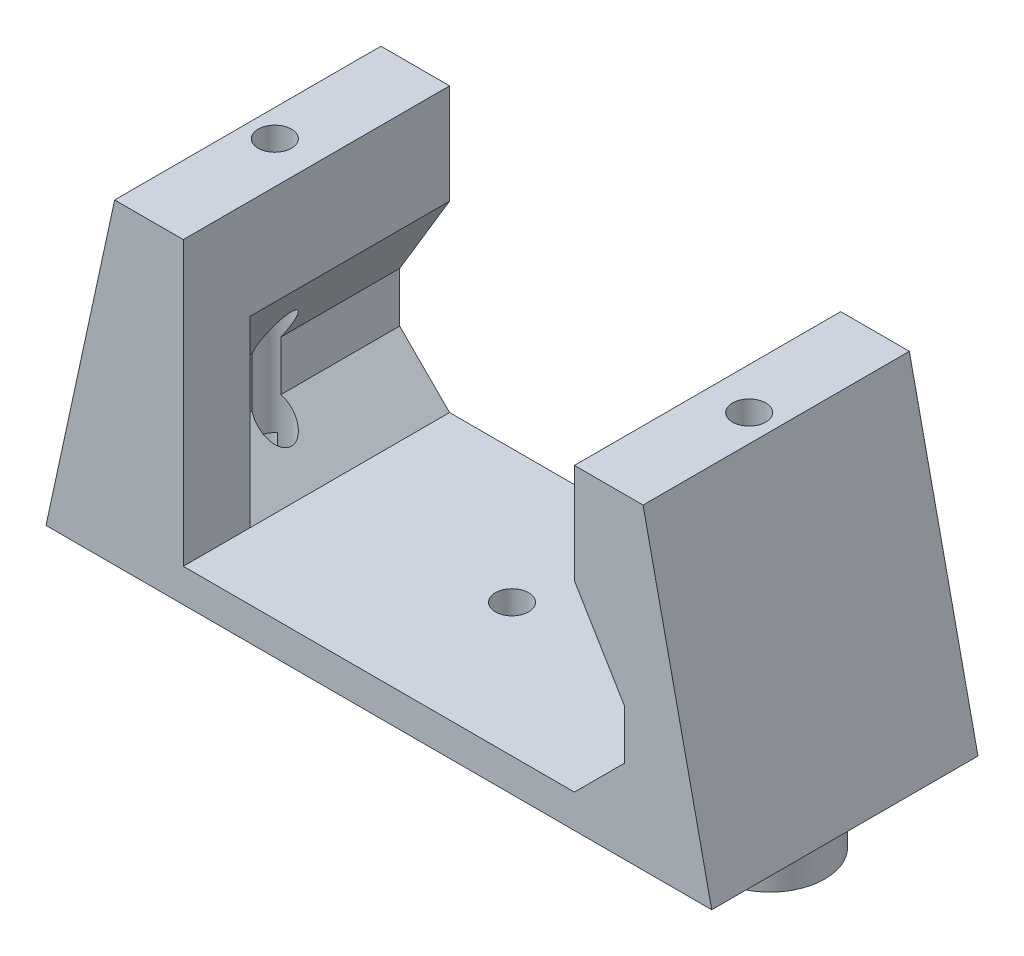
from build123d import *

# Parameters (mm, degrees)
ESBO_O1_W                = 40
ESBO_O1_H                = 16
RESSALTO_EXTRUS_O1_DEPTH = 2
ESBO_O1_4_W              = 8.25
ESBO_O1_4_H              = 16
ESBO_O1_4_R              = 1
RESSALTO_EXTRUS_O2_DEPTH = 19
ESBO_O2_R                = 3.3
ESBO_O2_R_2              = 1
RESSALTO_EXTRUS_O3_DEPTH = 3
CORTE_EXTRUS_O1_DEPTH    = 32.890437438
CORTE_EXTRUS_O3_DEPTH    = 12
CORTE_EXTRUS_O4_DEPTH    = 12
CHANFRO1_SIZE            = 3
CORTE_EXTRUS_O5_START    = -6
ESBO_O7_R                = 1
CORTE_EXTRUS_O5_DEPTH    = 6


with BuildPart() as part:
    # Esboço1 → Ressalto-extrusão1 (new body)
    with BuildSketch(Plane(origin=(0, 0, 0), x_dir=(1, 0, 0), z_dir=(0, 1, 0))):
        Rectangle(ESBO_O1_W, ESBO_O1_H)
    extrude(amount=RESSALTO_EXTRUS_O1_DEPTH)

    # Esboço1<4> → Ressalto-extrusão2 (add)
    # profile 1 of 2: a face of its own
    with BuildSketch(Plane(origin=(0, 0, 0), x_dir=(1, 0, 0), z_dir=(0, 1, 0))):
        with Locations((-15.875, 0)):
            Rectangle(ESBO_O1_4_W, ESBO_O1_4_H)
        with Locations(Location((-14.25, 0, 0), (0, 0, 270))):
            Circle(ESBO_O1_4_R, mode=Mode.SUBTRACT)
    # profile 2 of 2: a face of its own
    with BuildSketch(Plane(origin=(0, 0, 0), x_dir=(1, 0, 0), z_dir=(0, 1, 0))):
        with Locations((15.875, 0)):
            Rectangle(ESBO_O1_4_W, ESBO_O1_4_H)
        with Locations(Location((14.25, 0, 0), (0, 0, 270))):
            Circle(ESBO_O1_4_R, mode=Mode.SUBTRACT)
    extrude(amount=RESSALTO_EXTRUS_O2_DEPTH)

    # Esboço2 → Ressalto-extrusão3 (add)
    # profile 1 of 3: a face of its own
    with BuildSketch(Plane.XZ):
        with Locations(Location((0, 0, 0), (0, 0, 90))):
            Circle(ESBO_O2_R)
        with Locations(Location((0, 0, 0), (0, 0, 270))):
            Circle(ESBO_O2_R_2, mode=Mode.SUBTRACT)
    # profile 2 of 3: a face of its own
    with BuildSketch(Plane.XZ):
        with Locations(Location((-15.5, 0, 0), (0, 0, 90))):
            Circle(ESBO_O2_R)
        with Locations(Location((-15.5, 0, 0), (0, 0, 270))):
            Circle(ESBO_O2_R_2, mode=Mode.SUBTRACT)
    # profile 3 of 3: a face of its own
    with BuildSketch(Plane.XZ):
        with Locations(Location((15.5, 0, 0), (0, 0, 90))):
            Circle(ESBO_O2_R)
        with Locations(Location((15.5, 0, 0), (0, 0, 270))):
            Circle(ESBO_O2_R_2, mode=Mode.SUBTRACT)
    extrude(amount=RESSALTO_EXTRUS_O3_DEPTH)

    # Esboço3 → Corte-extrusão1 (cut, through all)
    with BuildSketch(Plane.XY.offset(8)):
        Polygon((15.875, 19), (20, 0), (20, 19), align=None)
        Polygon((-20, 0), (-15.875, 19), (-20, 19), align=None)
    extrude(amount=-CORTE_EXTRUS_O1_DEPTH, mode=Mode.SUBTRACT)

    # Esboço4 → Corte-extrusão3 (cut)
    with BuildSketch(Plane(origin=(0, 0, -8), x_dir=(-1, 0, 0), z_dir=(0, 0, -1))):
        Polygon((14.75, 8), (11.75, 13), (11.75, 5), (14.75, 5), align=None)
    extrude(amount=-CORTE_EXTRUS_O3_DEPTH, mode=Mode.SUBTRACT)

    # Esboço6 → Corte-extrusão4 (cut)
    with BuildSketch(Plane.XY.offset(8)):
        Polygon((14.75, 8), (11.75, 13), (11.75, 5), (14.75, 5), align=None)
    extrude(amount=-CORTE_EXTRUS_O4_DEPTH, mode=Mode.SUBTRACT)

    # Chanfro1
    # the kernel refuses this chamfer: 3 mm, written as the material it takes off along each edge
    with BuildSketch(Plane(origin=(11.75, 5, 15.715048964), x_dir=(-0.027495876610586202, -0.9996219169112968, 0), z_dir=(0, 0, -1))) as chanfro1_piece_1_section:
        Polygon((CHANFRO1_SIZE * 0.999621916911, -CHANFRO1_SIZE * 0.0274958766106), (-CHANFRO1_SIZE * 0.0274958766106, -CHANFRO1_SIZE * 0.999621916911), (0, 0), align=None)
    chanfro1_piece_1 = extrude(amount=19.715048964, mode=Mode.PRIVATE)
    chanfro1_piece_1 = split(chanfro1_piece_1, bisect_by=Plane(origin=(12.737731783, 2, 5.857524482), z_dir=(0, 1, 0)), keep=Keep.TOP, mode=Mode.PRIVATE)
    chanfro1_piece_1 = split(chanfro1_piece_1, bisect_by=Plane(origin=(14.75, 4.012268217, 5.857524482), z_dir=(-1, 0, 0)), keep=Keep.TOP, mode=Mode.PRIVATE)
    add(chanfro1_piece_1, mode=Mode.SUBTRACT)
    with BuildSketch(Plane(origin=(-11.75, 5, -15.715048964), x_dir=(0.027495876610586202, -0.9996219169112968, 0), z_dir=(0, 0, 1))) as chanfro1_piece_2_section:
        Polygon((CHANFRO1_SIZE * 0.999621916911, -CHANFRO1_SIZE * 0.0274958766106), (-CHANFRO1_SIZE * 0.0274958766106, -CHANFRO1_SIZE * 0.999621916911), (0, 0), align=None)
    chanfro1_piece_2 = extrude(amount=19.715048964, mode=Mode.PRIVATE)
    chanfro1_piece_2 = split(chanfro1_piece_2, bisect_by=Plane(origin=(-12.737731783, 2, -5.857524482), z_dir=(0, 1, 0)), keep=Keep.TOP, mode=Mode.PRIVATE)
    chanfro1_piece_2 = split(chanfro1_piece_2, bisect_by=Plane(origin=(-14.75, 4.012268217, -5.857524482), z_dir=(1, 0, 0)), keep=Keep.TOP, mode=Mode.PRIVATE)
    add(chanfro1_piece_2, mode=Mode.SUBTRACT)

    # Esboço7 → Corte-extrusão5 (cut)
    with BuildSketch(Plane.XZ.offset(3).offset(CORTE_EXTRUS_O5_START)):
        with Locations(Location((0, 0, 0), (0, 0, 90))):
            Circle(ESBO_O7_R)
        with Locations(Location((-15.5, 0, 0), (0, 0, 51.317812547))):
            Circle(ESBO_O7_R)
        with BuildLine():
            ThreePointArc((14.5, 0), (15.5, -1), (16.5, 0))
            Line((16.5, 0), (14.5, 0))
        make_face()
        with BuildLine():
            Line((14.5, 0), (16.5, 0))
            ThreePointArc((16.5, 0), (15.5, 1), (14.5, 0))
        make_face()
    extrude(amount=CORTE_EXTRUS_O5_DEPTH, mode=Mode.SUBTRACT)


solid = part.part
